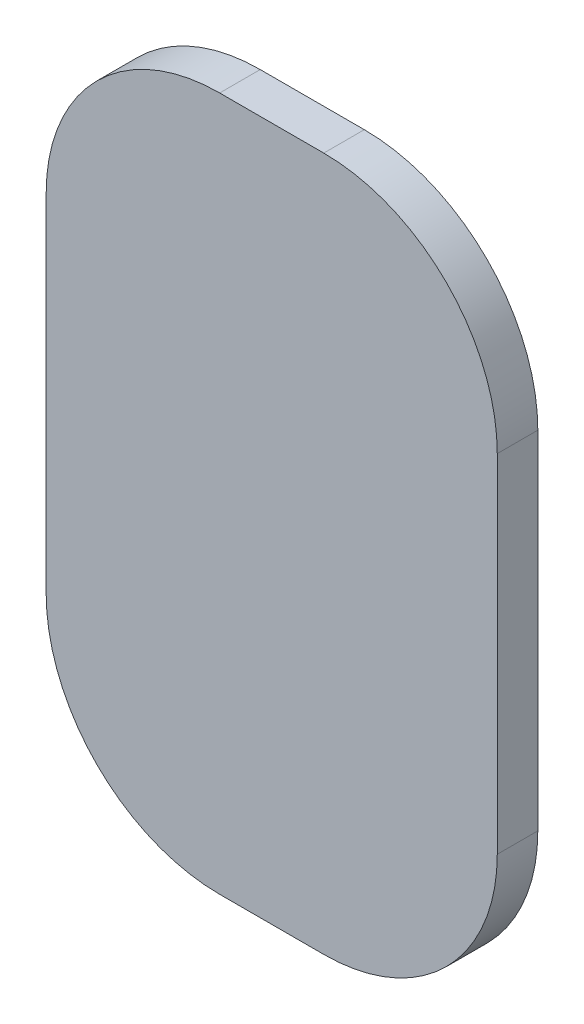
from build123d import *

# Parameters (mm, degrees)
SKETCH1_W          = 13
SKETCH1_H          = 20
BASE_FLANGE1_DEPTH = 1.1684
FILLET1_R          = 5


# Sheet-metal steps are written as plain solids
with BuildPart() as part:
    # Sketch1 → Base-Flange1 (new body)
    with BuildSketch(Plane.XY):
        with Locations((6.5, 10)):
            Rectangle(SKETCH1_W, SKETCH1_H)
    extrude(amount=-BASE_FLANGE1_DEPTH)

    # Fillet1
    fillet1_edges = [part.edges().sort_by_distance(p)[0] for p in [
        (0, 20, -0.5842),
        (13, 20, -0.5842),
        (13, 0, -0.5842),
        (0, 0, -0.5842),
    ]]
    fillet(fillet1_edges, radius=FILLET1_R)


solid = part.part
